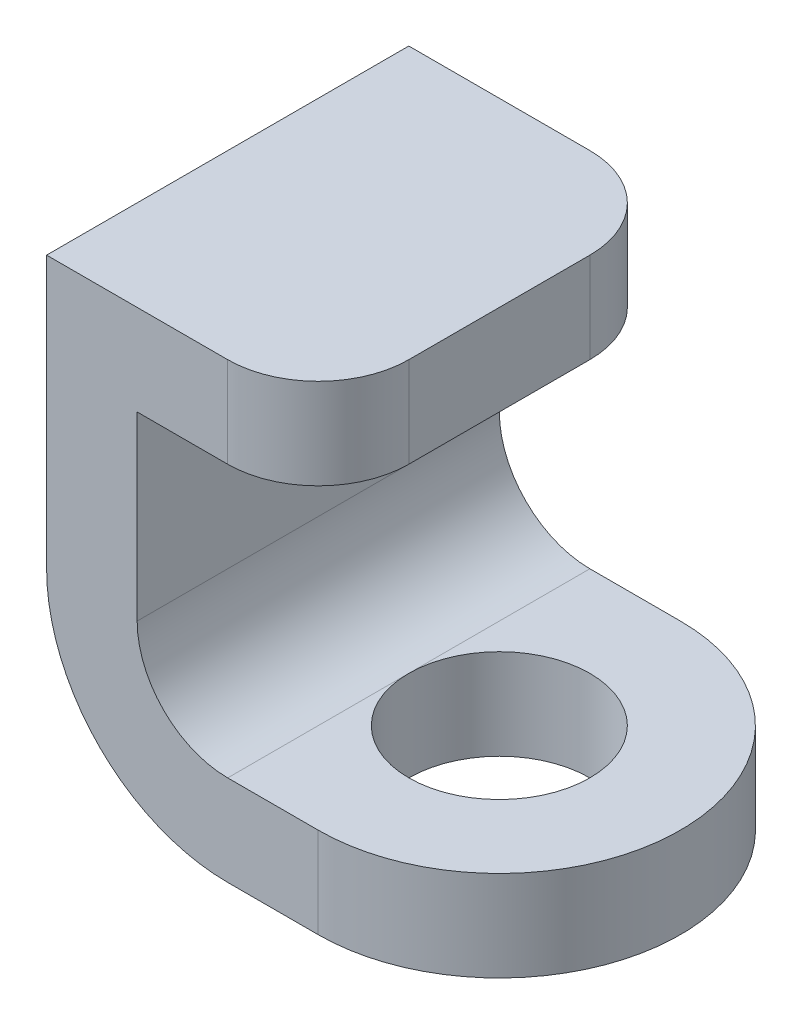
from build123d import *

# Parameters (mm, degrees)
SKETCH_1_R      = 1
EXTRUDE_1_DEPTH = 1
SKETCH_1_3_W    = 1
SKETCH_1_3_H    = 4
EXTRUDE_2_DEPTH = 5
SKETCH_2_W      = 4
SKETCH_2_H      = 1
EXTRUDE_3_DEPTH = 2
FILLET_1_R      = 1
FILLET_2_R      = 2
FILLET_3_R      = 1


with BuildPart() as part:
    # 草圖1 → 填料-伸長1 (new body)
    with BuildSketch(Plane(origin=(0, 0, 0), x_dir=(1, 0, 0), z_dir=(0, 1, 0))):
        with BuildLine():
            ThreePointArc((0, -2), (2, 0), (0, 2))
            Line((0, 2), (-2, 2))
            Line((-2, 2), (-2, -2))
            Line((-2, -2), (0, -2))
        make_face()
        with Locations(Location((0, 0, 0), (0, 0, 270))):
            Circle(SKETCH_1_R, mode=Mode.SUBTRACT)
    extrude(amount=EXTRUDE_1_DEPTH)

    # 草圖1<3> → 填料-伸長2 (add)
    with BuildSketch(Plane(origin=(0, 0, 0), x_dir=(1, 0, 0), z_dir=(0, 1, 0))):
        with Locations((-2.5, 0)):
            Rectangle(SKETCH_1_3_W, SKETCH_1_3_H)
    extrude(amount=EXTRUDE_2_DEPTH)

    # 草圖2 → 填料-伸長3 (add)
    with BuildSketch(Plane(origin=(-2, 0, 0), x_dir=(0, 0, -1), z_dir=(1, 0, 0))):
        with Locations((0, 4.5)):
            Rectangle(SKETCH_2_W, SKETCH_2_H)
    extrude(amount=EXTRUDE_3_DEPTH)

    # 圓角1
    fillet_1_edges = [part.edges().sort_by_distance(p)[0] for p in [
        (0, 4.5, 2),
        (0, 4.5, -2),
    ]]
    fillet(fillet_1_edges, radius=FILLET_1_R)

    # 圓角2
    fillet_2_edges = [part.edges().sort_by_distance(p)[0] for p in [
        (-3, 0, 0),
    ]]
    fillet(fillet_2_edges, radius=FILLET_2_R)

    # 圓角3
    fillet_3_edges = [part.edges().sort_by_distance(p)[0] for p in [
        (-2, 1, 0),
    ]]
    fillet(fillet_3_edges, radius=FILLET_3_R - 0.0001)  # a hair under: the kernel refuses the full size


solid = part.part
